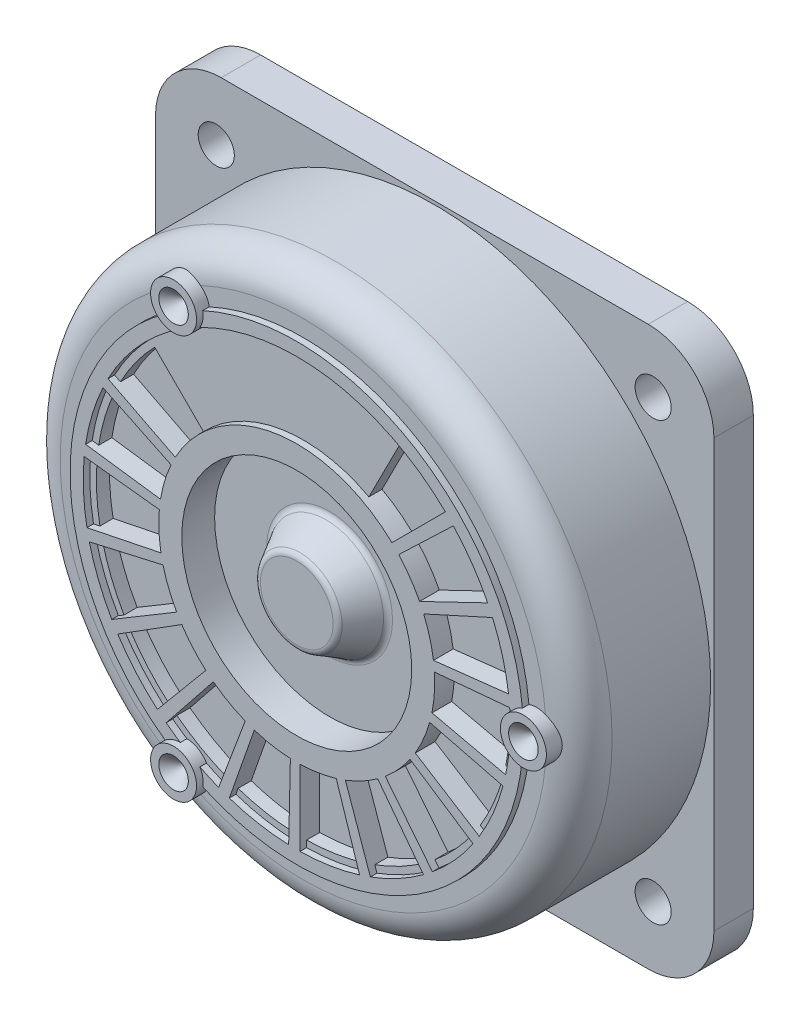
from build123d import *

# Parameters (mm, degrees)
SKETCH_1_W            = 85
SKETCH_1_H            = 85
EXTRUDE_1_DEPTH       = 6
FILLET_1_R            = 10
SKETCH_2_R            = 42
EXTRUDE_2_DEPTH       = 20
FILLET_2_R            = 5
CUT_EXTRUDE_1_DEPTH   = 2
EXTRUDE_START         = 1
SKETCH_4_R            = 34.5
EXTRUDE_3_DEPTH       = 1
SKETCH_5_R            = 17.5
CUT_EXTRUDE_3_DEPTH   = 5
SKETCH_6_R            = 9
EXTRUDE_4_DEPTH       = 5
EXTRUDE_4_TAPER       = 30
FILLET_3_R            = 1
EXTRUDE_5_DEPTH       = 2
EXTRUDE_5_DEPTH_BACK  = 15
SKETCH_7_R            = 3.5
SKETCH_8_R            = 2.25
CUT_EXTRUDE_4_DEPTH   = 2
CHAMFER_1_SIZE        = 2
HOLE_WIZARD_M51_D     = 5.5
HOLE_WIZARD_M51_DEPTH = 8.5
HOLE_WIZARD_M51_TIP   = 1.652366702


with BuildPart() as part:
    # Эскиз1 → Бобышка-Вытянуть1 (new body)
    with BuildSketch(Plane.XY):
        with Locations((42.5, 42.5)):
            Rectangle(SKETCH_1_W, SKETCH_1_H)
    extrude(amount=EXTRUDE_1_DEPTH)

    # Скругление1
    fillet_1_edges = [part.edges().sort_by_distance(p)[0] for p in [
        (0, 85, 3),
        (85, 85, 3),
        (85, 0, 3),
        (0, 0, 3),
    ]]
    fillet(fillet_1_edges, radius=FILLET_1_R)

    # Эскиз2 → Бобышка-Вытянуть2 (add)
    with BuildSketch(Plane.XY.offset(6)):
        with Locations((42.5, 42.5)):
            Circle(SKETCH_2_R)
    extrude(amount=EXTRUDE_2_DEPTH)

    # Скругление2
    fillet_2_edges = [part.edges().sort_by_distance(p)[0] for p in [
        (0.5, 42.5, 26),
    ]]
    fillet(fillet_2_edges, radius=FILLET_2_R)

    # Эскиз3 → Вырез-Вытянуть1 (cut)
    with BuildSketch(Plane.XY.offset(26)):
        with BuildLine():
            Line((61.198040686, 52.059459948), (70.660001971, 56.616100347))
            ThreePointArc((70.660001971, 56.616100347), (68.393065377, 60.438761535), (65.610701121, 63.904333526))
            Line((65.610701121, 63.904333526), (58.019920505, 56.646804146))
            ThreePointArc((58.019920505, 56.646804146), (59.762043584, 54.459174357), (61.198040686, 52.059459948))
        make_face()
        with BuildLine():
            Line((56.991479449, 57.69858623), (64.417504061, 65.124610842))
            ThreePointArc((64.417504061, 65.124610842), (61.015235447, 67.984035323), (57.244402341, 70.336174299))
            Line((57.244402341, 70.336174299), (52.476601049, 60.978837396))
            ThreePointArc((52.476601049, 60.978837396), (54.843490298, 59.489356882), (56.991479449, 57.69858623))
        make_face()
        with BuildLine():
            Line((63.306058378, 45.347443553), (73.742008823, 46.523292771))
            ThreePointArc((73.742008823, 46.523292771), (72.864830112, 50.880160635), (71.383208738, 55.070212925))
            Line((71.383208738, 55.070212925), (61.821387455, 50.727027824))
            ThreePointArc((61.821387455, 50.727027824), (62.743220075, 48.086773757), (63.306058378, 45.347443553))
        make_face()
        with BuildLine():
            Line((63.078942658, 38.31584906), (73.317620695, 35.978937612))
            ThreePointArc((73.317620695, 35.978937612), (73.928648564, 40.381026323), (73.914057387, 44.82529535))
            Line((73.914057387, 44.82529535), (63.45435057, 43.883904697))
            ThreePointArc((63.45435057, 43.883904697), (63.452432376, 41.087350882), (63.078942658, 38.31584906))
        make_face()
        with BuildLine():
            Line((60.542183483, 31.753855799), (69.434468086, 26.166463061))
            ThreePointArc((69.434468086, 26.166463061), (71.465124835, 30.119711503), (72.919201472, 34.319402112))
            Line((72.919201472, 34.319402112), (62.735536945, 36.885461324))
            ThreePointArc((62.735536945, 36.885461324), (61.810083224, 34.246474335), (60.542183483, 31.753855799))
        make_face()
        with BuildLine():
            Line((55.980489805, 26.397938188), (62.528370178, 18.187155905))
            ThreePointArc((62.528370178, 18.187155905), (65.750748421, 21.247877803), (68.510296994, 24.731644694))
            Line((68.510296994, 24.731644694), (59.745621435, 30.517156376))
            ThreePointArc((59.745621435, 30.517156376), (58.000498947, 28.331918535), (55.980489805, 26.397938188))
        make_face()
        with BuildLine():
            Line((49.905835741, 22.849208744), (53.374421403, 12.936560431))
            ThreePointArc((53.374421403, 12.936560431), (57.426862868, 14.761240747), (61.182170026, 17.138089127))
            Line((61.182170026, 17.138089127), (54.820172242, 25.493725983))
            ThreePointArc((54.820172242, 25.493725983), (52.451241912, 24.007493831), (49.905835741, 22.849208744))
        make_face()
        with BuildLine():
            Line((43, 21.505953225), (43, 11.003968504))
            ThreePointArc((43, 11.003968504), (47.427685649, 11.387817271), (51.75728073, 12.390985511))
            Line((51.75728073, 12.390985511), (48.511988976, 22.378966514))
            ThreePointArc((48.511988976, 22.378966514), (45.785123766, 21.758544847), (43, 21.505953225))
        make_face()
        with BuildLine():
            Line((36.03804759, 22.518929682), (32.569461927, 12.606281369))
            ThreePointArc((32.569461927, 12.606281369), (36.875457814, 11.506217959), (41.293415903, 11.023117136))
            Line((41.293415903, 11.023117136), (41.529060111, 21.522457824))
            ThreePointArc((41.529060111, 21.522457824), (38.750305209, 21.837478639), (36.03804759, 22.518929682))
        make_face()
        with BuildLine():
            Line((29.801341677, 25.774448386), (23.253461304, 17.563666103))
            ThreePointArc((23.253461304, 17.563666103), (26.954491131, 15.103154306), (30.964970039, 13.188004439))
            Line((30.964970039, 13.188004439), (34.655103072, 23.020328745))
            ThreePointArc((34.655103072, 23.020328745), (32.136327421, 24.235436204), (29.801341677, 25.774448386))
        make_face()
        with BuildLine():
            Line((24.989848594, 30.9071316), (16.097563991, 25.319738862))
            ThreePointArc((16.097563991, 25.319738862), (18.778248821, 21.774930133), (21.931139107, 18.642674887))
            Line((21.931139107, 18.642674887), (28.661605013, 26.704468221))
            ThreePointArc((28.661605013, 26.704468221), (26.685499214, 28.683286755), (24.989848594, 30.9071316))
        make_face()
        with BuildLine():
            Line((22.143578276, 37.340921148), (11.904900239, 35.004009699))
            ThreePointArc((11.904900239, 35.004009699), (13.264377862, 30.77274976), (15.20582012, 26.774932601))
            Line((15.20582012, 26.774932601), (24.221236234, 32.161392976))
            ThreePointArc((24.221236234, 32.161392976), (23.009585241, 34.681833174), (22.143578276, 37.340921148))
        make_face()
        with BuildLine():
            Line((21.581977146, 44.353731344), (11.146026701, 45.529580561))
            ThreePointArc((11.146026701, 45.529580561), (11.031718404, 41.086757844), (11.543818087, 36.672067142))
            Line((11.543818087, 36.672067142), (21.832354153, 38.778654122))
            ThreePointArc((21.832354153, 38.778654122), (21.521145603, 41.557838563), (21.581977146, 44.353731344))
        make_face()
        with BuildLine():
            Line((23.368075575, 51.15849108), (13.90611429, 55.715131479))
            ThreePointArc((13.90611429, 55.715131479), (12.330849274, 51.559378814), (11.356131725, 47.223290049))
            Line((11.356131725, 47.223290049), (21.763070982, 45.813574342))
            ThreePointArc((21.763070982, 45.813574342), (22.38723285, 48.539585876), (23.368075575, 51.15849108))
        make_face()
        with BuildLine():
            Line((27.30141377, 56.991479449), (19.875389158, 64.417504061))
            ThreePointArc((19.875389158, 64.417504061), (17.015964677, 61.015235447), (14.663825701, 57.244402341))
            Line((14.663825701, 57.244402341), (24.021162604, 52.476601049))
            ThreePointArc((24.021162604, 52.476601049), (25.510643118, 54.843490298), (27.30141377, 56.991479449))
        make_face()
    extrude(amount=-CUT_EXTRUDE_1_DEPTH, mode=Mode.SUBTRACT)

    # Эскиз4 → Бобышка-Вытянуть3 (add)
    with BuildSketch(Plane.XY.offset(26).offset(EXTRUDE_START)):
        with Locations((42.5, 42.5)):
            Circle(SKETCH_4_R)
        with BuildLine():
            Line((13.772710365, 57.698448283), (24.021162604, 52.476601049))
            ThreePointArc((24.021162604, 52.476601049), (39.214876234, 63.241455152), (56.991479449, 57.69858623))
            Line((56.991479449, 57.69858623), (65.124697196, 65.831803977))
            ThreePointArc((65.124697196, 65.831803977), (37.415879886, 74.599871069), (13.772710365, 57.698448283))
        make_face(mode=Mode.SUBTRACT)
        with BuildLine():
            Line((23.368075575, 51.15849108), (13.005035394, 56.149068205))
            ThreePointArc((13.005035394, 56.149068205), (11.373098458, 51.846978142), (10.365060946, 47.357539708))
            Line((10.365060946, 47.357539708), (21.763070982, 45.813574342))
            ThreePointArc((21.763070982, 45.813574342), (22.38723285, 48.539585876), (23.368075575, 51.15849108))
        make_face(mode=Mode.SUBTRACT)
        with BuildLine():
            Line((61.198040686, 52.059459948), (71.561080867, 57.050037073))
            ThreePointArc((71.561080867, 57.050037073), (69.215067452, 61.008246028), (66.333584254, 64.59548057))
            Line((66.333584254, 64.59548057), (58.019920505, 56.646804146))
            ThreePointArc((58.019920505, 56.646804146), (59.762043584, 54.459174357), (61.198040686, 52.059459948))
        make_face(mode=Mode.SUBTRACT)
        with BuildLine():
            Line((60.542183483, 31.753855799), (70.281295689, 25.634366011))
            ThreePointArc((70.281295689, 25.634366011), (72.384652608, 29.726686471), (73.889009413, 34.075031867))
            Line((73.889009413, 34.075031867), (62.735536945, 36.885461324))
            ThreePointArc((62.735536945, 36.885461324), (61.810083224, 34.246474335), (60.542183483, 31.753855799))
        make_face(mode=Mode.SUBTRACT)
        with BuildLine():
            Line((63.306058378, 45.347443553), (74.735842387, 46.63527092))
            ThreePointArc((74.735842387, 46.63527092), (73.828792973, 51.146197481), (72.293797475, 55.483821934))
            Line((72.293797475, 55.483821934), (61.821387455, 50.727027824))
            ThreePointArc((61.821387455, 50.727027824), (62.743220075, 48.086773757), (63.306058378, 45.347443553))
        make_face(mode=Mode.SUBTRACT)
        with BuildLine():
            Line((63.078942658, 38.31584906), (74.292667668, 35.756389503))
            ThreePointArc((74.292667668, 35.756389503), (74.926383439, 40.313757318), (74.910153312, 44.914945605))
            Line((74.910153312, 44.914945605), (63.45435057, 43.883904697))
            ThreePointArc((63.45435057, 43.883904697), (63.452432376, 41.087350882), (63.078942658, 38.31584906))
        make_face(mode=Mode.SUBTRACT)
        with BuildLine():
            Line((55.980489805, 26.397938188), (63.151936122, 17.405228943))
            ThreePointArc((63.151936122, 17.405228943), (66.488867418, 20.573207257), (69.344972168, 24.180680436))
            Line((69.344972168, 24.180680436), (59.745621435, 30.517156376))
            ThreePointArc((59.745621435, 30.517156376), (58.000498947, 28.331918535), (55.980489805, 26.397938188))
        make_face(mode=Mode.SUBTRACT)
        with BuildLine():
            Line((43, 21.505953225), (43, 10.003846381))
            ThreePointArc((43, 10.003846381), (47.584120114, 10.400128931), (52.066335462, 11.439812849))
            Line((52.066335462, 11.439812849), (48.511988976, 22.378966514))
            ThreePointArc((48.511988976, 22.378966514), (45.785123766, 21.758544847), (43, 21.505953225))
        make_face(mode=Mode.SUBTRACT)
        with BuildLine():
            Line((49.905835741, 22.849208744), (53.704740799, 11.992561831))
            ThreePointArc((53.704740799, 11.992561831), (57.90073153, 13.880645215), (61.788034051, 16.342367415))
            Line((61.788034051, 16.342367415), (54.820172242, 25.493725983))
            ThreePointArc((54.820172242, 25.493725983), (52.451241912, 24.007493831), (49.905835741, 22.849208744))
        make_face(mode=Mode.SUBTRACT)
        with BuildLine():
            Line((36.03804759, 22.518929682), (32.239142531, 11.662282769))
            ThreePointArc((32.239142531, 11.662282769), (36.696900919, 10.522288371), (41.270975098, 10.02324681))
            Line((41.270975098, 10.02324681), (41.529060111, 21.522457824))
            ThreePointArc((41.529060111, 21.522457824), (38.750305209, 21.837478639), (36.03804759, 22.518929682))
        make_face(mode=Mode.SUBTRACT)
        with BuildLine():
            Line((29.801341677, 25.774448386), (22.62989536, 16.781739141))
            ThreePointArc((22.62989536, 16.781739141), (26.460982913, 14.233413172), (30.613552304, 12.251655233))
            Line((30.613552304, 12.251655233), (34.655103072, 23.020328745))
            ThreePointArc((34.655103072, 23.020328745), (32.136327421, 24.235436204), (29.801341677, 25.774448386))
        make_face(mode=Mode.SUBTRACT)
        with BuildLine():
            Line((24.989848594, 30.9071316), (15.250736388, 24.787641812))
            ThreePointArc((15.250736388, 24.787641812), (18.025177355, 21.116991407), (21.290185227, 17.8749364))
            Line((21.290185227, 17.8749364), (28.661605013, 26.704468221))
            ThreePointArc((28.661605013, 26.704468221), (26.685499214, 28.683286755), (24.989848594, 30.9071316))
        make_face(mode=Mode.SUBTRACT)
        with BuildLine():
            Line((22.143578276, 37.340921148), (10.929853266, 34.781461591))
            ThreePointArc((10.929853266, 34.781461591), (12.336262873, 30.400456102), (14.347266491, 26.261970687))
            Line((14.347266491, 26.261970687), (24.221236234, 32.161392976))
            ThreePointArc((24.221236234, 32.161392976), (23.009585241, 34.681833174), (22.143578276, 37.340921148))
        make_face(mode=Mode.SUBTRACT)
        with BuildLine():
            Line((21.581977146, 44.353731344), (10.152193137, 45.64155871))
            ThreePointArc((10.152193137, 45.64155871), (10.032725337, 41.041893014), (10.564023049, 36.47145323))
            Line((10.564023049, 36.47145323), (21.832354153, 38.778654122))
            ThreePointArc((21.832354153, 38.778654122), (21.521145603, 41.557838563), (21.581977146, 44.353731344))
        make_face(mode=Mode.SUBTRACT)
    extrude(amount=-EXTRUDE_3_DEPTH)

    # Эскиз5 → Вырез-Вытянуть3 (cut)
    with BuildSketch(Plane.XY.offset(27)):
        with Locations((42.5, 42.5)):
            Circle(SKETCH_5_R)
    extrude(amount=-CUT_EXTRUDE_3_DEPTH, mode=Mode.SUBTRACT)

    # Эскиз6 → Бобышка-Вытянуть4 (add)
    with BuildSketch(Plane.XY.offset(22)):
        with Locations((42.5, 42.5)):
            Circle(SKETCH_6_R)
    extrude(amount=EXTRUDE_4_DEPTH, taper=EXTRUDE_4_TAPER)

    # Скругление3
    fillet_3_edges = [part.edges().sort_by_distance(p)[0] for p in [
        (33.5, 42.5, 22),
        (36.386751346, 42.5, 27),
    ]]
    fillet(fillet_3_edges, radius=FILLET_3_R)

    # Эскиз7 → Бобышка-Вытянуть5 (add, two sides: drawn at the far end of the back side and taken through both)
    with BuildSketch(Plane.XY.offset(26).offset(-EXTRUDE_5_DEPTH_BACK)):
        with Locations((24.75, 73.243901834)):
            Circle(SKETCH_7_R)
        with Locations((78, 42.5)):
            Circle(SKETCH_7_R)
        with Locations((24.75, 11.756098166)):
            Circle(SKETCH_7_R)
    extrude(amount=EXTRUDE_5_DEPTH + EXTRUDE_5_DEPTH_BACK)

    # Эскиз8 → Вырез-Вытянуть4 (cut)
    with BuildSketch(Plane.XY.offset(28)):
        with Locations((24.75, 11.756098166)):
            Circle(SKETCH_8_R)
        with Locations((78, 42.5)):
            Circle(SKETCH_8_R)
        with Locations((24.75, 73.243901834)):
            Circle(SKETCH_8_R)
    extrude(amount=-CUT_EXTRUDE_4_DEPTH, mode=Mode.SUBTRACT)

    # Фаска1
    chamfer_1_edges = [part.edges().sort_by_distance(p)[0] for p in [
        (22.5, 11.756098166, 26),
        (75.75, 42.5, 26),
        (22.5, 73.243901834, 26),
    ]]
    chamfer(chamfer_1_edges, length=CHAMFER_1_SIZE - 0.0001)  # a hair under: the kernel refuses the full size

    # Отверстие с зазором M51
    with Locations(Plane.XY.offset(6)):
        with Locations((9.25, 75.75), (75.75, 75.75), (75.75, 9.25), (9.25, 9.25)):
            Hole(HOLE_WIZARD_M51_D / 2, depth=HOLE_WIZARD_M51_DEPTH)
            with Locations((0, 0, -(HOLE_WIZARD_M51_DEPTH + HOLE_WIZARD_M51_TIP / 2))):  # 118° drill point
                Cone(0, HOLE_WIZARD_M51_D / 2, HOLE_WIZARD_M51_TIP, mode=Mode.SUBTRACT)


solid = part.part
